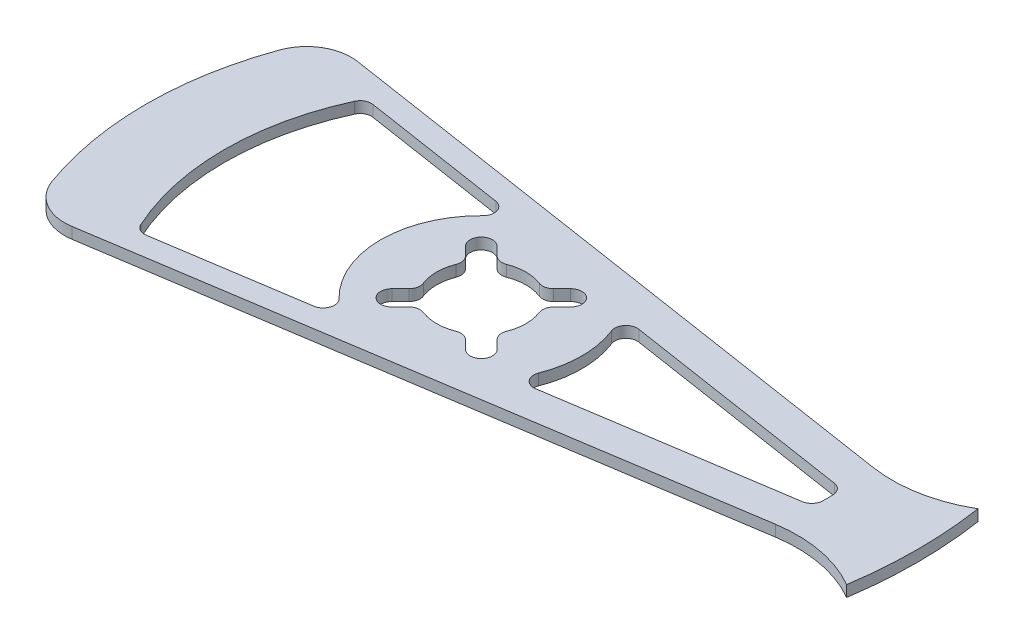
from build123d import *

# Parameters (mm, degrees)
BOSS_EXTRUDE1_DEPTH = 6.35
FILLET1_R           = 6.35
FILLET2_R           = 25.4
FILLET3_R           = 6.35


with BuildPart() as part:
    # Sketch1 → Boss-Extrude1 (new body)
    with BuildSketch(Plane(origin=(0, 0, 0), x_dir=(1, 0, 0), z_dir=(0, 1, 0))):
        with BuildLine():
            Line((194.872934042, 27.82915877), (-170.916556976, 84.129546246))
            ThreePointArc((-170.916556976, 84.129546246), (-190.5, 0), (-170.916556976, -84.129546246))
            Line((-170.916556976, -84.129546246), (194.872934042, -27.82915877))
            ThreePointArc((194.872934042, -27.82915877), (220.662117475, -28.27659702), (244.824613145, -37.301894031))
            ThreePointArc((244.824613145, -37.301894031), (247.65, 0), (244.824613145, 37.301894031))
            ThreePointArc((244.824613145, 37.301894031), (220.662117475, 28.27659702), (194.872934042, 27.82915877))
        make_face()
        with BuildLine():
            ThreePointArc((-130.60870167, -65.076024595), (-145.923, 0), (-130.60870167, 65.076024595))
            Line((-130.60870167, 65.076024595), (-28.741073501, 49.39709702))
            ThreePointArc((-28.741073501, 49.39709702), (-57.15, 0), (-28.741073501, -49.39709702))
            Line((-28.741073501, -49.39709702), (-130.60870167, -65.076024595))
        make_face(mode=Mode.SUBTRACT)
        with BuildLine():
            ThreePointArc((47.897230141, -31.17655922), (57.15, 0), (47.897230141, 31.17655922))
            Line((47.897230141, 31.17655922), (196.675896516, 8.277332285))
            ThreePointArc((196.675896516, 8.277332285), (196.85, 0), (196.675896516, -8.277332285))
            Line((196.675896516, -8.277332285), (47.897230141, -31.17655922))
        make_face(mode=Mode.SUBTRACT)
        with BuildLine():
            Line((-21.880319261, 12.90006314), (-29.890128061, 20.909871939))
            ThreePointArc((-29.890128061, 20.909871939), (-29.890128061, 29.890128061), (-20.909871939, 29.890128061))
            Line((-20.909871939, 29.890128061), (-12.90006314, 21.880319261))
            ThreePointArc((-12.90006314, 21.880319261), (0, 25.4), (12.90006314, 21.880319261))
            Line((12.90006314, 21.880319261), (20.909871939, 29.890128061))
            ThreePointArc((20.909871939, 29.890128061), (27.830039796, 31.266635031), (31.75, 25.4))
            ThreePointArc((31.75, 25.4), (31.266635031, 22.969960204), (29.890128061, 20.909871939))
            Line((29.890128061, 20.909871939), (21.880319261, 12.90006314))
            ThreePointArc((21.880319261, 12.90006314), (24.504286454, 6.685801775), (25.4, 0))
            ThreePointArc((25.4, 0), (24.504286454, -6.685801775), (21.880319261, -12.90006314))
            Line((21.880319261, -12.90006314), (29.890128061, -20.909871939))
            ThreePointArc((29.890128061, -20.909871939), (31.266635031, -22.969960204), (31.75, -25.4))
            ThreePointArc((31.75, -25.4), (27.830039796, -31.266635031), (20.909871939, -29.890128061))
            Line((20.909871939, -29.890128061), (12.90006314, -21.880319261))
            ThreePointArc((12.90006314, -21.880319261), (0, -25.4), (-12.90006314, -21.880319261))
            Line((-12.90006314, -21.880319261), (-20.909871939, -29.890128061))
            ThreePointArc((-20.909871939, -29.890128061), (-29.890128061, -29.890128061), (-29.890128061, -20.909871939))
            Line((-29.890128061, -20.909871939), (-21.880319261, -12.90006314))
            ThreePointArc((-21.880319261, -12.90006314), (-25.4, 0), (-21.880319261, 12.90006314))
        make_face(mode=Mode.SUBTRACT)
    extrude(amount=BOSS_EXTRUDE1_DEPTH)

    # Fillet1
    fillet1_edges = [part.edges().sort_by_distance(p)[0] for p in [
        (47.897230141, 3.175, 31.17655922),
        (47.897230141, 3.175, -31.17655922),
        (196.675896516, 3.175, -8.277332285),
        (196.675896516, 3.175, 8.277332285),
        (-130.60870167, 3.175, -65.076024595),
        (-130.60870167, 3.175, 65.076024595),
        (-28.741073501, 3.175, -49.39709702),
        (-28.741073501, 3.175, 49.39709702),
    ]]
    fillet(fillet1_edges, radius=FILLET1_R)

    # Fillet2
    fillet2_edges = [part.edges().sort_by_distance(p)[0] for p in [
        (-170.916556976, 3.175, -84.129546246),
        (-170.916556976, 3.175, 84.129546246),
    ]]
    fillet(fillet2_edges, radius=FILLET2_R)

    # Fillet3
    fillet3_edges = [part.edges().sort_by_distance(p)[0] for p in [
        (-12.90006314, 3.175, 21.880319261),
        (12.90006314, 3.175, 21.880319261),
        (21.880319261, 3.175, 12.90006314),
        (21.880319261, 3.175, -12.90006314),
        (-12.90006314, 3.175, -21.880319261),
        (12.90006314, 3.175, -21.880319261),
        (-21.880319261, 3.175, -12.90006314),
        (-21.880319261, 3.175, 12.90006314),
    ]]
    fillet(fillet3_edges, radius=FILLET3_R)


solid = part.part
